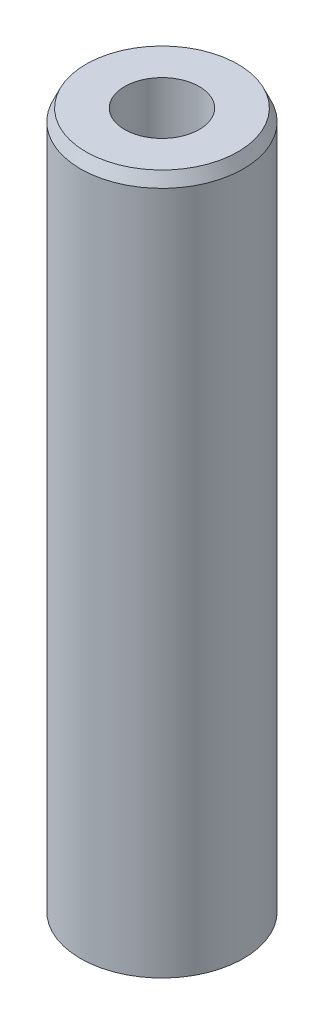
from build123d import *
from OCP.BRepFilletAPI import BRepFilletAPI_MakeChamfer

# Parameters (mm, degrees)
SKETCH1_R           = 20
BOSS_EXTRUDE1_DEPTH = 172.157615914
SKETCH2_R           = 9.154437623
CUT_EXTRUDE1_DEPTH  = 175.465597518
CHAMFER1_SIZE       = 2.943041625
CHAMFER1_SIZE2      = 1.354402754


with BuildPart() as part:
    # Sketch1 → Boss-Extrude1 (new body)
    with BuildSketch(Plane(origin=(0, 0, 0), x_dir=(1, 0, 0), z_dir=(0, 1, 0))):
        Circle(SKETCH1_R)
    extrude(amount=BOSS_EXTRUDE1_DEPTH)

    # Sketch2 → Cut-Extrude1 (cut, through all)
    with BuildSketch(Plane(origin=(0, 0, 0), x_dir=(1, 0, 0), z_dir=(0, 1, 0))):
        Circle(SKETCH2_R)
    extrude(amount=CUT_EXTRUDE1_DEPTH, mode=Mode.SUBTRACT)

    # Chamfer1: one chamfer whose edges measure the first distance from different faces: ONE call of the kernel's chamfer builder (chamfer() names one face for all edges)
    chamfer1_edges_1 = [part.edges().sort_by_distance(p)[0] for p in [
        (-20, 172.157615914, 0),
    ]]
    chamfer1_side_1 = [part.faces().sort_by_distance(p)[0] for p in [
        (-20, 86.078807957, 0),
    ]]
    chamfer1_edges_2 = [part.edges().sort_by_distance(p)[0] for p in [
        (-20, 0, 0),
    ]]
    chamfer1_side_2 = [part.faces().sort_by_distance(p)[0] for p in [
        (-19.434314575, 0, 0),
    ]]
    chamfer1 = BRepFilletAPI_MakeChamfer(part.part.solid().wrapped)
    for e in chamfer1_edges_1:
        chamfer1.Add(CHAMFER1_SIZE, CHAMFER1_SIZE2, e.wrapped, chamfer1_side_1[0].wrapped)  # the first distance lies on this face
    for e in chamfer1_edges_2:
        chamfer1.Add(CHAMFER1_SIZE, CHAMFER1_SIZE2, e.wrapped, chamfer1_side_2[0].wrapped)  # the first distance lies on this face
    add(Compound.cast(chamfer1.Shape()), mode=Mode.REPLACE)


solid = part.part
